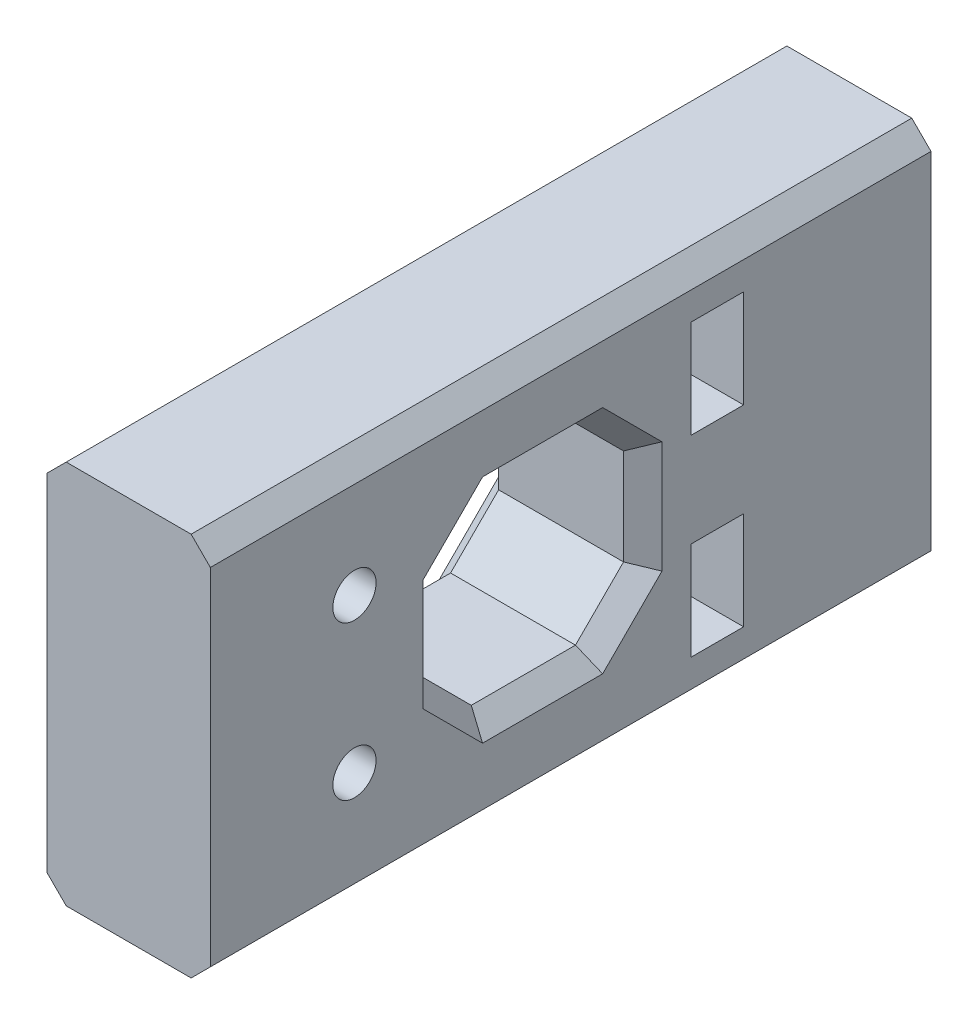
from build123d import *

# Parameters (mm, degrees)
SKETCH1_W                = 17
SKETCH1_H                = 40
BOSS_EXTRUDE1_DEPTH      = 75
M4_CLEARANCE_HOLE1_D     = 4.5
M4_CLEARANCE_HOLE1_DEPTH = 15
M4_CLEARANCE_HOLE1_TIP   = 1.351936393
CUT_EXTRUDE1_DEPTH       = 3.3
M6_CLEARANCE_HOLE1_D     = 6.6
M6_CLEARANCE_HOLE1_DEPTH = 29
M6_CLEARANCE_HOLE1_TIP   = 1.982840043
CUT_EXTRUDE2_START       = -25
CUT_EXTRUDE2_DEPTH       = 5.5
SKETCH11_W               = 5.5
SKETCH11_H               = 10.2
CUT_EXTRUDE3_DEPTH       = 10
CHAMFER1_START           = -8.5
CHAMFER1_DEPTH           = 17
CHAMFER2_SIZE            = 2
CHAMFER3_SIZE            = 2


with BuildPart() as part:
    # Sketch1 → Boss-Extrude1 (new body)
    with BuildSketch(Plane.XY):
        Rectangle(SKETCH1_W, SKETCH1_H)
    extrude(amount=-BOSS_EXTRUDE1_DEPTH)

    # M4 Clearance Hole1
    with Locations(Plane(origin=(8.5, 0, 0), x_dir=(0, 0, -1), z_dir=(1, 0, 0))):
        with Locations((15, 8), (15, -8)):
            Hole(M4_CLEARANCE_HOLE1_D / 2, depth=M4_CLEARANCE_HOLE1_DEPTH)
            with Locations((0, 0, -(M4_CLEARANCE_HOLE1_DEPTH + M4_CLEARANCE_HOLE1_TIP / 2))):  # 118° drill point
                Cone(0, M4_CLEARANCE_HOLE1_D / 2, M4_CLEARANCE_HOLE1_TIP, mode=Mode.SUBTRACT)

    # Sketch6 → Cut-Extrude1 (cut)
    with BuildSketch(Plane.ZY.offset(8.5)):
        Polygon((-10.843078062, 8), (-12.921539031, 11.6), (-17.078460969, 11.6), (-19.156921938, 8), (-17.078460969, 4.4), (-12.921539031, 4.4), align=None)
        Polygon((-10.843078062, -8), (-12.921539031, -4.4), (-17.078460969, -4.4), (-19.156921938, -8), (-17.078460969, -11.6), (-12.921539031, -11.6), align=None)
    extrude(amount=-CUT_EXTRUDE1_DEPTH, mode=Mode.SUBTRACT)

    # M6 Clearance Hole1
    with Locations(Plane(origin=(0, 0, -75), x_dir=(-1, 0, 0), z_dir=(0, 0, -1))):
        with Locations((1.5, -10), (1.5, 10)):
            Hole(M6_CLEARANCE_HOLE1_D / 2, depth=M6_CLEARANCE_HOLE1_DEPTH)
            with Locations((0, 0, -(M6_CLEARANCE_HOLE1_DEPTH + M6_CLEARANCE_HOLE1_TIP / 2))):  # 118° drill point
                Cone(0, M6_CLEARANCE_HOLE1_D / 2, M6_CLEARANCE_HOLE1_TIP, mode=Mode.SUBTRACT)

    # Sketch10 → Cut-Extrude2 (cut)
    with BuildSketch(Plane(origin=(0, 0, -75), x_dir=(-1, 0, 0), z_dir=(0, 0, -1)).offset(CUT_EXTRUDE2_START)):
        Polygon((7.388972746, 10), (4.444486373, 15.1), (-1.444486373, 15.1), (-4.388972746, 10), (-1.444486373, 4.9), (4.444486373, 4.9), align=None)
        Polygon((7.388972746, -10), (4.444486373, -4.9), (-1.444486373, -4.9), (-4.388972746, -10), (-1.444486373, -15.1), (4.444486373, -15.1), align=None)
    extrude(amount=CUT_EXTRUDE2_DEPTH, mode=Mode.SUBTRACT)

    # Sketch11 → Cut-Extrude3 (cut)
    with BuildSketch(Plane(origin=(8.5, 0, 0), x_dir=(0, 0, -1), z_dir=(1, 0, 0))):
        with Locations((52.75, 10)):
            Rectangle(SKETCH11_W, SKETCH11_H)
        with Locations((52.75, -10)):
            Rectangle(SKETCH11_W, SKETCH11_H)
    extrude(amount=-CUT_EXTRUDE3_DEPTH, mode=Mode.SUBTRACT)

    # Chamfer1: read off the stored shape, not the designer's step
    # Chamfer1 outline → Chamfer1 (cut)
    with BuildSketch(Plane.YZ.offset(CHAMFER1_START)):
        Polygon((-5, -24.156921938), (-10, -29.156921938), (-10, -40), (-5, -45), (5, -45), (10, -40), (10, -29.156921938), (5, -24.156921938), align=None)
    extrude(amount=CHAMFER1_DEPTH, mode=Mode.SUBTRACT)

    # Chamfer2
    chamfer2_edges = [part.edges().sort_by_distance(p)[0] for p in [
        (-8.5, 20, -37.5),
        (8.5, 20, -37.5),
        (8.5, -20, -37.5),
        (-8.5, -20, -37.5),
    ]]
    chamfer(chamfer2_edges, length=CHAMFER2_SIZE)

    # Chamfer3
    chamfer3_edges = [part.edges().sort_by_distance(p)[0] for p in [
        (-8.5, -10, -34.578460969),
        (8.5, -10, -34.578460969),
        (-8.5, 0, -24.156921938),
        (8.5, 0, -24.156921938),
        (-8.5, 10, -34.578460969),
        (8.5, 10, -34.578460969),
        (-8.5, 0, -45),
        (8.5, 0, -45),
        (8.5, -7.5, -26.656921938),
        (-8.5, -7.5, -26.656921938),
        (8.5, 7.5, -26.656921938),
        (-8.5, 7.5, -26.656921938),
        (8.5, 7.5, -42.5),
        (-8.5, 7.5, -42.5),
        (8.5, -7.5, -42.5),
        (-8.5, -7.5, -42.5),
    ]]
    chamfer(chamfer3_edges, length=CHAMFER3_SIZE)


solid = part.part
